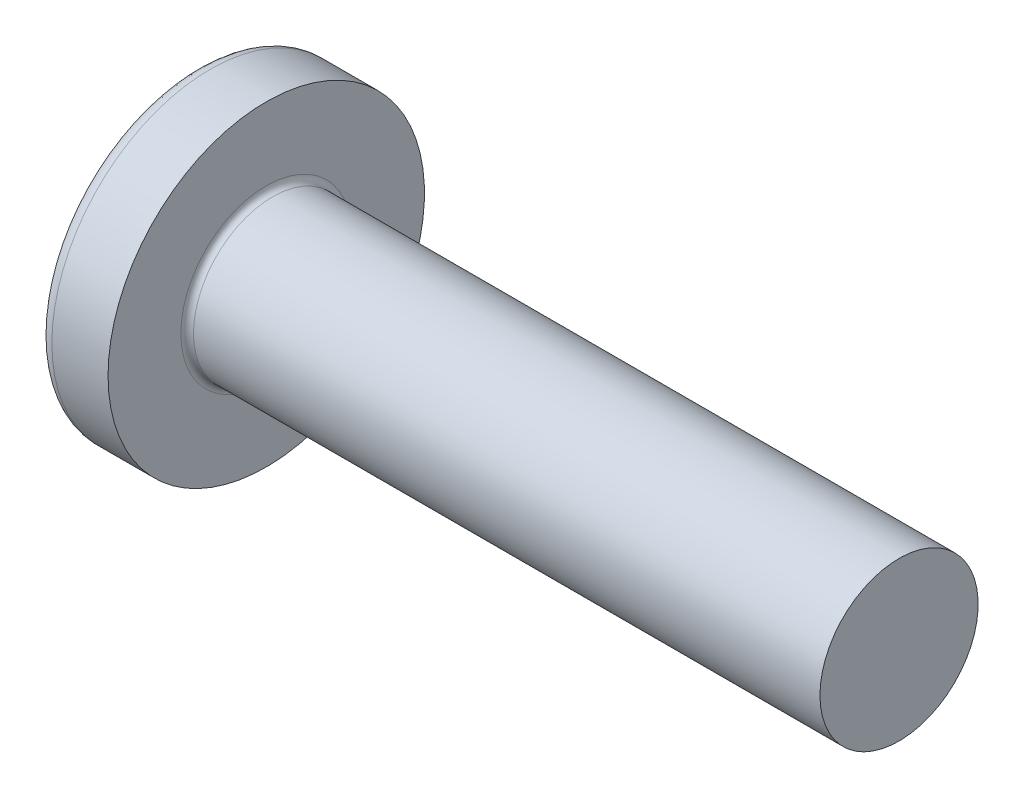
from build123d import *

# Parameters (mm, degrees)
FILLET1_R    = 0.4
RECPAT_COUNT = 2
RECPAT_ANGLE = 90


with BuildPart() as part:
    # BodySke → BaseBody (revolve)
    with BuildSketch(Plane.XY):
        with BuildLine():
            Line((0, 0), (47.5, 0))
            Line((47.5, 0), (47.5, 5))
            Line((47.5, 5), (7.5, 5))
            Line((7.5, 5), (7.5, 10))
            Line((7.5, 10), (3.950103735, 10))
            ThreePointArc((3.950103735, 10), (3.548946469, 9.905650574), (3.231897997, 9.642384106))
            ThreePointArc((3.231897997, 9.642384106), (0.82947542, 5.084799306), (0, 0))
        make_face()
    revolve(axis=Axis((0, 0, 0), (1, 0, 0)))

    # Fillet1
    fillet1_edges = [part.edges().sort_by_distance(p)[0] for p in [
        (7.5, -5, 0),
    ]]
    fillet(fillet1_edges, radius=FILLET1_R)

    # RecessTopSke → Recess section 0
    with BuildSketch(Plane(origin=(0, 0, 0), x_dir=(0, 0, -1), z_dir=(1, 0, 0))):
        with BuildLine():
            Line((-1.08, 4.95), (1.08, 4.95))
            Line((1.08, 4.95), (1.08, -4.95))
            Line((1.08, -4.95), (-1.08, -4.95))
            Line((-1.08, -4.95), (-1.08, 4.95))
        make_face()
    # RecessBottomSke → Recess section 1
    with BuildSketch(Plane(origin=(5.69, 0, 0), x_dir=(0, 0, -1), z_dir=(1, 0, 0))):
        with BuildLine():
            Line((-1.08, -2.1285), (1.08, -2.1285))
            Line((1.08, -2.1285), (1.08, 2.1285))
            Line((1.08, 2.1285), (-1.08, 2.1285))
            Line((-1.08, 2.1285), (-1.08, -2.1285))
        make_face()
    recess = loft(mode=Mode.SUBTRACT)

    # RecPat: Recess ×2 about axis
    recpat_axis = Axis((0, 0, 0), (1, 0, 0))
    for i in range(1, RECPAT_COUNT):
        add(recess.rotate(recpat_axis, i * RECPAT_ANGLE / (RECPAT_COUNT - 1)), mode=Mode.SUBTRACT)

    # RecessCoreSke → RecessCore (revolve, cut)
    with BuildSketch(Plane.XY):
        Polygon((0, 0), (6.317257474, 0), (5.69, 1.9305), (0, 2.32838356), align=None)
    revolve(axis=Axis((0, 0, 0), (1, 0, 0)), mode=Mode.SUBTRACT)


solid = part.part
